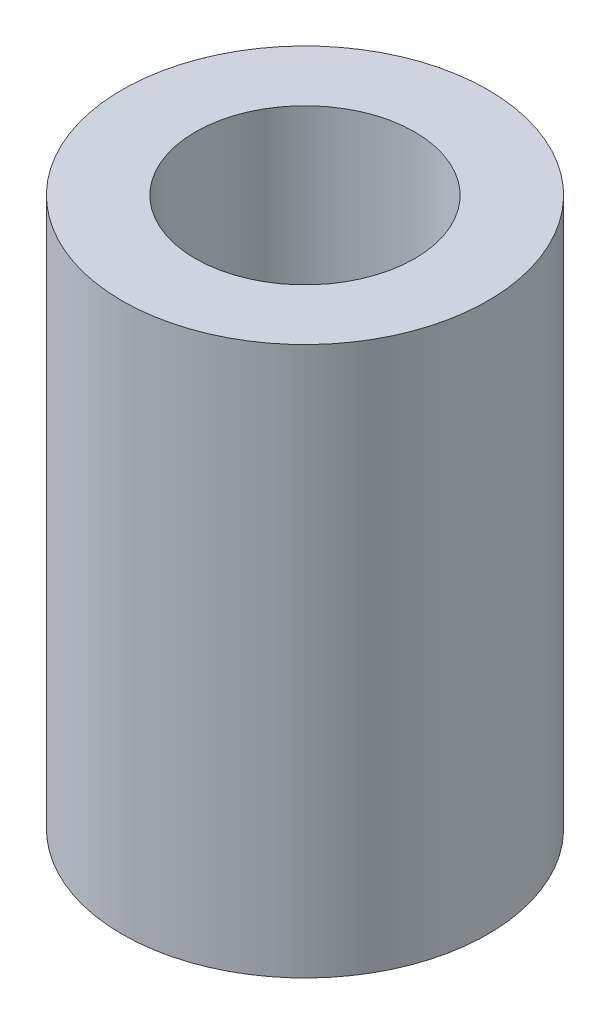
from build123d import *

# Parameters (mm, degrees)
SKETCH_1_R      = 5
SKETCH_1_R_2    = 3
EXTRUDE_1_DEPTH = 15


with BuildPart() as part:
    # 草图1 → 凸台-拉伸1 (new body)
    with BuildSketch(Plane(origin=(0, 0, 0), x_dir=(1, 0, 0), z_dir=(0, 1, 0))):
        Circle(SKETCH_1_R)
        Circle(SKETCH_1_R_2, mode=Mode.SUBTRACT)
    extrude(amount=EXTRUDE_1_DEPTH)


solid = part.part
